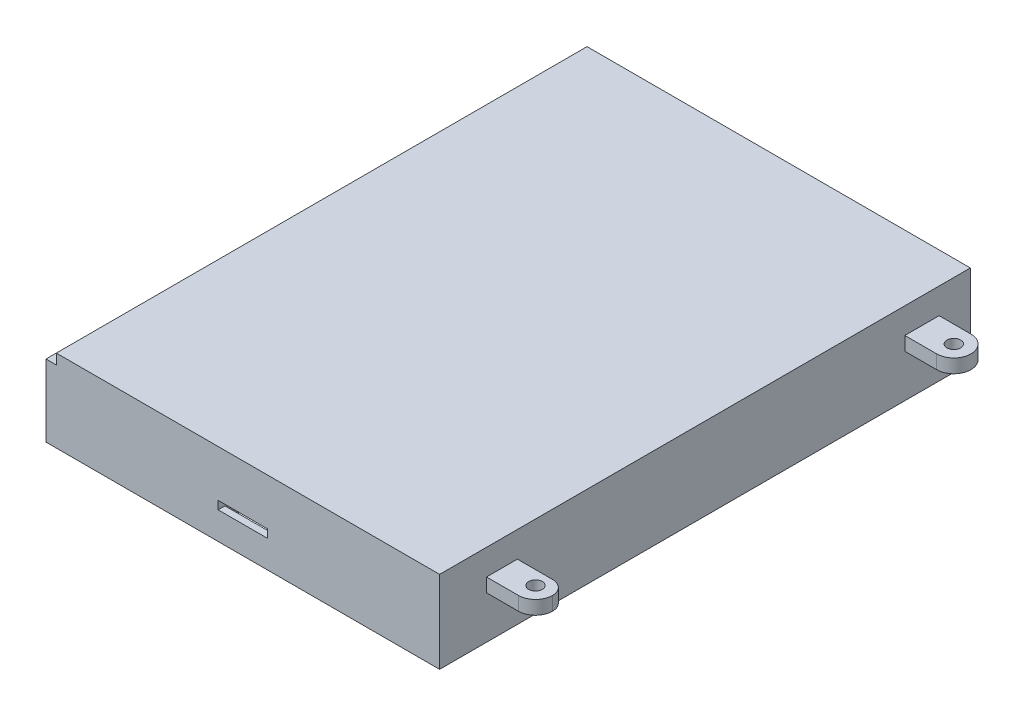
from build123d import *

# Parameters (mm, degrees)
SKETCH1_R                = 1
SKETCH1_W                = 55.4
SKETCH1_H                = 71.4
BOSS_EXTRUDE1_DEPTH      = 5
SKETCH2_W                = 55.4
SKETCH2_H                = 71.4
BOSS_EXTRUDE2_DEPTH      = 1.5
SKETCH4_W                = 7.703515063
SKETCH4_H                = 8.608986158
CUT_EXTRUDE1_DEPTH       = 105.5
MOVE_FACE1_BY            = 7
MOVE_FACE2_BY            = 7.5
MOVE_FACE3_BY            = 4
MOVE_FACE3_2_BY          = 4
MOVE_FACE4_BY            = 4
MOVE_FACE4_2_BY          = 4
MOVE_FACE5_BY            = 0.4
MOVE_FACE5_2_BY          = 0.4
MOVE_FACE6_BY            = 0.4
MOVE_FACE6_2_BY          = 0.4
MOVE_START               = 3
MOVE_FACE7_OUTLINE_W     = 58.4
MOVE_FACE7_OUTLINE_H     = 74.4
MOVE_FACE7_OUTLINE_W_2   = 55.4
MOVE_FACE7_OUTLINE_H_2   = 71.4
MOVE_FACE7_DEPTH         = 2
MOVE_START_2             = -25.141552832
MOVE_FACE8_OUTLINE_W     = 0.5
MOVE_FACE8_OUTLINE_H     = 10
MOVE_FACE8_DEPTH         = 56
MOVE_START_3             = -33.2
MOVE_FACE8_2_OUTLINE_W   = 58.4
MOVE_FACE8_2_OUTLINE_H   = 10
MOVE_FACE8_2_DEPTH       = 0.5
MOVE_START_4             = 40.7
MOVE_FACE8_3_OUTLINE_W   = 58.4
MOVE_FACE8_3_OUTLINE_H   = 10
MOVE_FACE8_3_DEPTH       = 0.5
MOVE_START_5             = -32.7
MOVE_FACE8_4_OUTLINE_W   = 0.5
MOVE_FACE8_4_OUTLINE_H   = 10
MOVE_FACE8_4_OUTLINE_H_2 = 1
MOVE_FACE8_4_DEPTH       = 73.4
MOVE_START_6             = 35.858447168
MOVE_FACE8_5_OUTLINE_W   = 0.5
MOVE_FACE8_5_OUTLINE_H   = 9
MOVE_FACE8_5_DEPTH       = 4.841552832
MOVE_FACE8_6_OUTLINE_W   = 0.5
MOVE_FACE8_6_OUTLINE_H   = 9
MOVE_FACE8_6_DEPTH       = 2.558447168
CUT_EXTRUDE2_DEPTH       = 66
CUT_EXTRUDE2_DEPTH_BACK  = 64
SKETCH5_W                = 9.341764375
SKETCH5_H                = 8.237393027
CUT_EXTRUDE3_DEPTH       = 4
FILLET3_R                = 2
MOVE_FACE9_OUTLINE_W     = 57.4
MOVE_FACE9_OUTLINE_H     = 73.4
MOVE_FACE9_OUTLINE_W_2   = 55.4
MOVE_FACE9_OUTLINE_H_2   = 71.4
MOVE_FACE9_DEPTH         = 2.5
SKETCH7_W                = 57.4
SKETCH7_H                = 73.4
BOSS_EXTRUDE3_DEPTH      = 0.5
SKETCH8_W                = 57.4
SKETCH8_H                = 73.4
CUT_EXTRUDE4_DEPTH       = 1
MOVE_FACE10_BY           = 0.25
MOVE_FACE10_2_BY         = 0.25
MOVE_FACE11_BY           = 0.25
MOVE_FACE11_2_BY         = 0.25
SKETCH9_W                = 1.5
SKETCH9_H                = 73.4
CUT_EXTRUDE5_DEPTH       = 1.5
MOVE_START_7             = -34.7
MOVE_FACE12_DEPTH        = 2
MOVE_FACE12_2_DEPTH      = 2
CUT_EXTRUDE6_DEPTH       = 5.2
SKETCH12_W               = 7.2
SKETCH12_H               = 1.2
CUT_EXTRUDE7_DEPTH       = 108.2


# Read off the part's stored shape, not the designer's step: Move Face7, Move Face8, Move Face9, Move Face12
with BuildPart() as part:
    # Sketch1 → Boss-Extrude1 (new body)
    with BuildSketch(Plane(origin=(0, 0, 0), x_dir=(1, 0, 0), z_dir=(0, 1, 0))):
        with BuildLine():
            Line((26.077909727, -37.2), (26.077909727, -35.858447168))
            Line((26.077909727, -35.858447168), (29.822090273, -35.858447168))
            ThreePointArc((29.822090273, -35.858447168), (32.322090273, -33.358447168), (29.822090273, -30.858447168))
            Line((29.822090273, -30.858447168), (26.077909727, -30.858447168))
            Line((26.077909727, -30.858447168), (26.077909727, 25.141552832))
            Line((26.077909727, 25.141552832), (29.822090273, 25.141552832))
            ThreePointArc((29.822090273, 25.141552832), (32.322090273, 27.641552832), (29.822090273, 30.141552832))
            Line((29.822090273, 30.141552832), (26.077909727, 30.141552832))
            Line((26.077909727, 30.141552832), (26.077909727, 37.2))
            Line((26.077909727, 37.2), (-32.322090273, 37.2))
            Line((-32.322090273, 37.2), (-32.322090273, -37.2))
            Line((-32.322090273, -37.2), (26.077909727, -37.2))
        make_face()
        with Locations(Location((29.822090273, 27.641552832, 0), (0, 0, 270))):
            Circle(SKETCH1_R, mode=Mode.SUBTRACT)
        with Locations(Location((29.822090273, -33.358447168, 0), (0, 0, 270))):
            Circle(SKETCH1_R, mode=Mode.SUBTRACT)
        with Locations((-3.122090273, 0)):
            Rectangle(SKETCH1_W, SKETCH1_H, mode=Mode.SUBTRACT)
    extrude(amount=BOSS_EXTRUDE1_DEPTH)

    # Sketch2 → Boss-Extrude2 (add)
    with BuildSketch(Plane(origin=(0, 0, 0), x_dir=(1, 0, 0), z_dir=(0, 1, 0))):
        with Locations((-3.122090273, 0)):
            Rectangle(SKETCH2_W, SKETCH2_H)
    extrude(amount=BOSS_EXTRUDE2_DEPTH)

    # Sketch4 → Cut-Extrude1 (cut)
    with BuildSketch(Plane.XY.offset(35.858447168)):
        with Locations((29.929667259, 6.304493079)):
            Rectangle(SKETCH4_W, SKETCH4_H)
    extrude(amount=-CUT_EXTRUDE1_DEPTH, mode=Mode.SUBTRACT)

    # Move Face1: a face moved outward by 7.0
    extrude(part.faces().sort_by_distance((-2.752621979, 0, 0.033029774))[0], amount=MOVE_FACE1_BY, dir=(0, -1, 0))

    # Move Face2: a face moved inward by 7.5
    extrude(part.faces().sort_by_distance((-3.122090273, 1.5, 0))[0], amount=MOVE_FACE2_BY, dir=(0, -1, 0), mode=Mode.SUBTRACT)

    # Move Face3: a face moved outward by 4.0
    extrude(part.faces().sort_by_distance((-3.122090273, -1, 37.2))[0], amount=MOVE_FACE3_BY, dir=(0, 0, 1))

    # Move Face3 2: a face moved outward by 4.0
    extrude(part.faces().sort_by_distance((-3.122090273, -0.5, -35.7))[0], amount=MOVE_FACE3_2_BY, dir=(0, 0, 1))

    # Move Face4: a face moved inward by 4.0
    extrude(part.faces().sort_by_distance((-3.122090273, -0.5, 35.7))[0], amount=MOVE_FACE4_BY, dir=(0, 0, 1), mode=Mode.SUBTRACT)

    # Move Face4 2: a face moved inward by 4.0
    extrude(part.faces().sort_by_distance((-3.122090273, -1, -37.2))[0], amount=MOVE_FACE4_2_BY, dir=(0, 0, 1), mode=Mode.SUBTRACT)

    # Move Face5: a face moved outward by 0.4
    extrude(part.faces().sort_by_distance((24.577909727, -0.5, 4))[0], amount=MOVE_FACE5_BY, dir=(-1, 0, 0))

    # Move Face5 2: a face moved outward by 0.4
    extrude(part.faces().sort_by_distance((-32.322090273, -1, 4))[0], amount=MOVE_FACE5_2_BY, dir=(-1, 0, 0))

    # Move Face6: a face moved inward by 0.4
    extrude(part.faces().sort_by_distance((-30.822090273, -0.5, 4))[0], amount=MOVE_FACE6_BY, dir=(-1, 0, 0), mode=Mode.SUBTRACT)

    # Move Face6 2: a face moved inward by 0.4
    extrude(part.faces().sort_by_distance((26.077909727, -0.831838565, 4.127976775))[0], amount=MOVE_FACE6_2_BY, dir=(-1, 0, 0), mode=Mode.SUBTRACT)

    # Move Face7 outline → Move Face7 (cut)
    with BuildSketch(Plane(origin=(0, 0, 0), x_dir=(1, 0, 0), z_dir=(0, 1, 0)).offset(MOVE_START)):
        with Locations((-3.522090273, -4)):
            Rectangle(MOVE_FACE7_OUTLINE_W, MOVE_FACE7_OUTLINE_H)
        with Locations((-3.522090273, -4)):
            Rectangle(MOVE_FACE7_OUTLINE_W_2, MOVE_FACE7_OUTLINE_H_2, mode=Mode.SUBTRACT)
    extrude(amount=MOVE_FACE7_DEPTH, mode=Mode.SUBTRACT)

    # Move Face8 outline → Move Face8 (cut)
    with BuildSketch(Plane.XY.offset(MOVE_START_2)):
        with Locations((-32.472090273, -2)):
            Rectangle(MOVE_FACE8_OUTLINE_W, MOVE_FACE8_OUTLINE_H)
        with Locations((25.427909727, -2)):
            Rectangle(MOVE_FACE8_OUTLINE_W, MOVE_FACE8_OUTLINE_H)
    extrude(amount=MOVE_FACE8_DEPTH, mode=Mode.SUBTRACT)

    # Move Face8 2 outline → Move Face8 2 (cut)
    with BuildSketch(Plane.XY.offset(MOVE_START_3)):
        with Locations((-3.522090273, -2)):
            Rectangle(MOVE_FACE8_2_OUTLINE_W, MOVE_FACE8_2_OUTLINE_H)
    extrude(amount=MOVE_FACE8_2_DEPTH, mode=Mode.SUBTRACT)

    # Move Face8 3 outline → Move Face8 3 (cut)
    with BuildSketch(Plane.XY.offset(MOVE_START_4)):
        with Locations((-3.522090273, -2)):
            Rectangle(MOVE_FACE8_3_OUTLINE_W, MOVE_FACE8_3_OUTLINE_H)
    extrude(amount=MOVE_FACE8_3_DEPTH, mode=Mode.SUBTRACT)

    # Move Face8 4 outline → Move Face8 4 (cut)
    with BuildSketch(Plane.XY.offset(MOVE_START_5)):
        with Locations((-32.472090273, -2)):
            Rectangle(MOVE_FACE8_4_OUTLINE_W, MOVE_FACE8_4_OUTLINE_H)
        with Locations((25.427909727, 2.5)):
            Rectangle(MOVE_FACE8_4_OUTLINE_W, MOVE_FACE8_4_OUTLINE_H_2)
    extrude(amount=MOVE_FACE8_4_DEPTH, mode=Mode.SUBTRACT)

    # Move Face8 5 outline → Move Face8 5 (cut)
    with BuildSketch(Plane.XY.offset(MOVE_START_6)):
        with Locations((25.427909727, -2.5)):
            Rectangle(MOVE_FACE8_5_OUTLINE_W, MOVE_FACE8_5_OUTLINE_H)
    extrude(amount=MOVE_FACE8_5_DEPTH, mode=Mode.SUBTRACT)

    # Move Face8 6 outline → Move Face8 6 (cut)
    with BuildSketch(Plane.XY.offset(MOVE_START_5)):
        with Locations((25.427909727, -2.5)):
            Rectangle(MOVE_FACE8_6_OUTLINE_W, MOVE_FACE8_6_OUTLINE_H)
    extrude(amount=MOVE_FACE8_6_DEPTH, mode=Mode.SUBTRACT)

    # Sketch5 → Cut-Extrude2 (cut, two sides: drawn at the far end of the back side and taken through both)
    with BuildSketch(Plane.XY.offset(-CUT_EXTRUDE2_DEPTH_BACK)):
        with Locations((29.848791915, -4.118696514)):
            Rectangle(SKETCH5_W, SKETCH5_H)
    extrude(amount=CUT_EXTRUDE2_DEPTH + CUT_EXTRUDE2_DEPTH_BACK, mode=Mode.SUBTRACT)

    # Sketch6 → Cut-Extrude3 (cut)
    with BuildSketch(Plane(origin=(0, 2, 0), x_dir=(1, 0, 0), z_dir=(0, 1, 0))):
        Polygon((25.177909727, -30.858447168), (25.177909727, -31.358447168), (32.688438313, -31.358447168), (32.688438313, -30.19770306), (25.177909727, -30.19770306), align=None)
    extrude(amount=-CUT_EXTRUDE3_DEPTH, mode=Mode.SUBTRACT)

    # Fillet3
    fillet3_edges = [part.edges().sort_by_distance(p)[0] for p in [
        (31.322090273, 1, 31.358447168),
    ]]
    fillet(fillet3_edges, radius=FILLET3_R)

    # Move Face9 outline → Move Face9 (add)
    with BuildSketch(Plane(origin=(0, 0, 0), x_dir=(1, 0, 0), z_dir=(0, 1, 0)).offset(MOVE_START)):
        with Locations((-3.522090273, -4)):
            Rectangle(MOVE_FACE9_OUTLINE_W, MOVE_FACE9_OUTLINE_H)
        with Locations((-3.522090273, -4)):
            Rectangle(MOVE_FACE9_OUTLINE_W_2, MOVE_FACE9_OUTLINE_H_2, mode=Mode.SUBTRACT)
    extrude(amount=MOVE_FACE9_DEPTH)

    # Sketch7 → Boss-Extrude3 (add)
    with BuildSketch(Plane(origin=(0, 5.5, 0), x_dir=(1, 0, 0), z_dir=(0, 1, 0))):
        with Locations((-3.522090273, -4)):
            Rectangle(SKETCH7_W, SKETCH7_H)
    extrude(amount=BOSS_EXTRUDE3_DEPTH)

    # Sketch8 → Cut-Extrude4 (cut)
    with BuildSketch(Plane.XZ.offset(7)):
        with Locations((-3.522090273, 4)):
            Rectangle(SKETCH8_W, SKETCH8_H)
    extrude(amount=-CUT_EXTRUDE4_DEPTH, mode=Mode.SUBTRACT)

    # Move Face10: a face moved inward by 0.25
    extrude(part.faces().sort_by_distance((28.366938403, 0, -27.641552832))[0], amount=MOVE_FACE10_BY, dir=(0, 1, 0), mode=Mode.SUBTRACT)

    # Move Face10 2: a face moved inward by 0.25
    extrude(part.faces().sort_by_distance((28.373500925, 0, 33.610852536))[0], amount=MOVE_FACE10_2_BY, dir=(0, 1, 0), mode=Mode.SUBTRACT)

    # Move Face11: a face moved outward by 0.25
    extrude(part.faces().sort_by_distance((28.373500925, 2, 33.610852536))[0], amount=MOVE_FACE11_BY, dir=(0, 1, 0))

    # Move Face11 2: a face moved outward by 0.25
    extrude(part.faces().sort_by_distance((28.366938403, 2, -27.641552832))[0], amount=MOVE_FACE11_2_BY, dir=(0, 1, 0))

    # Sketch9 → Cut-Extrude5 (cut)
    with BuildSketch(Plane(origin=(0, 6, 0), x_dir=(1, 0, 0), z_dir=(0, 1, 0))):
        with Locations((-31.472090273, -4)):
            Rectangle(SKETCH9_W, SKETCH9_H)
    extrude(amount=-CUT_EXTRUDE5_DEPTH, mode=Mode.SUBTRACT)

    # Move Face12 outline → Move Face12 (add)
    with BuildSketch(Plane.XY.offset(MOVE_START_7)):
        Polygon((-32.222090273, 4.5), (-32.222090273, -6), (25.177909727, -6), (25.177909727, 6), (-30.722090273, 6), (-30.722090273, 4.5), align=None)
    extrude(amount=MOVE_FACE12_DEPTH)

    # Move Face12 2 outline → Move Face12 2 (add)
    with BuildSketch(Plane.XY.offset(MOVE_START_4)):
        Polygon((-32.222090273, 4.5), (-32.222090273, -6), (25.177909727, -6), (25.177909727, 6), (-30.722090273, 6), (-30.722090273, 4.5), align=None)
    extrude(amount=MOVE_FACE12_2_DEPTH)

    # Sketch10 → Cut-Extrude6 (cut)
    with BuildSketch(Plane.XZ.offset(6)):
        Polygon((-3.522090273, 41.7), (0.077909727, 41.7), (0.077909727, 38.920271818), (-7.122090273, 38.920271818), (-7.122090273, 41.7), align=None)
        Polygon((-7.122090273, -33.7), (-3.522090273, -33.7), (0.077909727, -33.7), (0.077909727, -30.920271818), (-7.122090273, -30.920271818), align=None)
    extrude(amount=-CUT_EXTRUDE6_DEPTH, mode=Mode.SUBTRACT)

    # Sketch12 → Cut-Extrude7 (cut)
    with BuildSketch(Plane.XY.offset(42.7)):
        with Locations((-3.522090273, -1.4)):
            Rectangle(SKETCH12_W, SKETCH12_H)
    extrude(amount=-CUT_EXTRUDE7_DEPTH, mode=Mode.SUBTRACT)


solid = part.part
